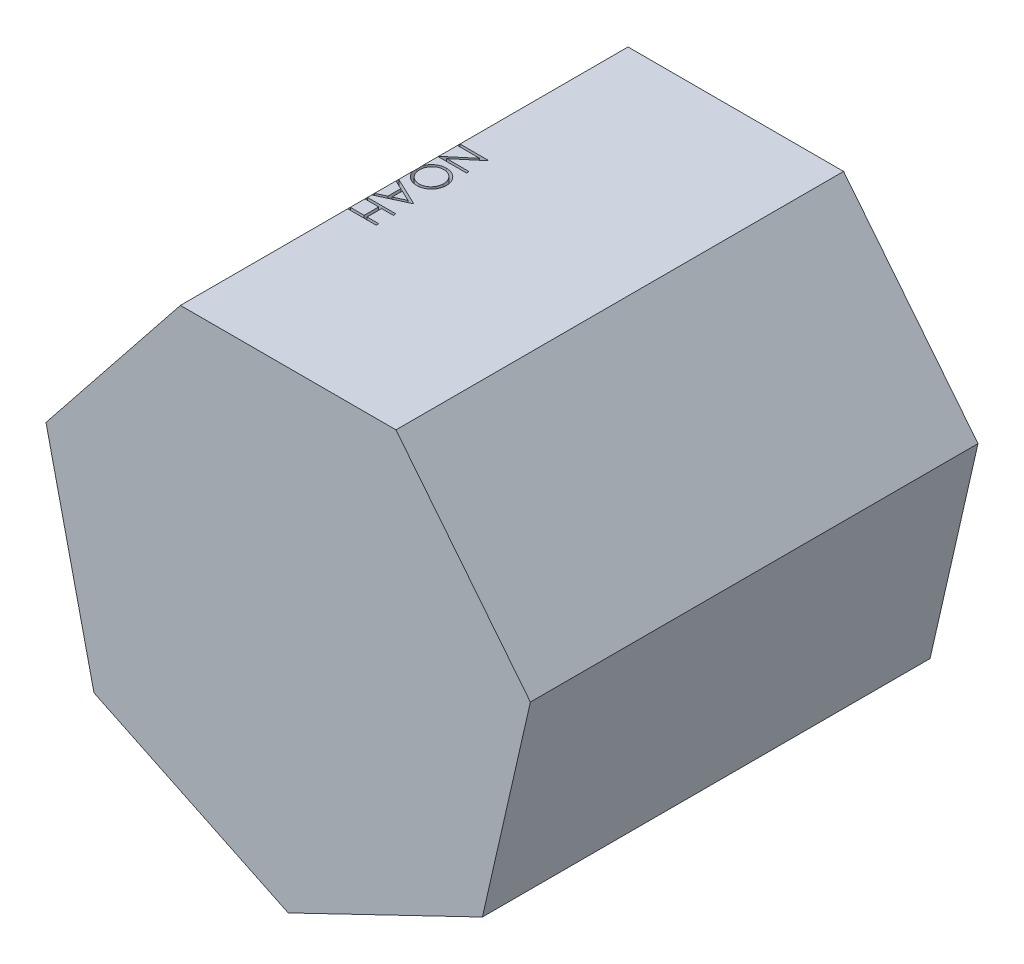
from build123d import *

# Parameters (mm, degrees)
BOSS_EXTRUDE1_DEPTH = 200
CUT_EXTRUDE1_DEPTH  = 1
SKETCH4_W           = 1.794871794
SKETCH4_H           = 20.512820513
SKETCH4_W_2         = 1.794871795
SKETCH4_H_2         = 14.615384616
CUT_EXTRUDE3_DEPTH  = 1
CUT_EXTRUDE5_DEPTH  = 2
CUT_EXTRUDE6_DEPTH  = 10
SKETCH9_W           = 12.5
SKETCH9_H           = 1.121794872
CUT_EXTRUDE7_DEPTH  = 5


with BuildPart() as part:
    # Sketch1 → Boss-Extrude1 (new body)
    with BuildSketch(Plane.XY):
        Polygon((0, -110.991626417), (86.776747824, -69.202147163), (108.208834613, 24.697960372), (48.157461881, 100), (-48.157461881, 100), (-108.208834613, 24.697960372), (-86.776747824, -69.202147163), align=None)
    extrude(amount=BOSS_EXTRUDE1_DEPTH)

    # Sketch2 → Cut-Extrude1 (cut)
    # profile 1 of 6: a face of its own
    with BuildSketch(Plane(origin=(-78.183148247, 62.348980186, 0), x_dir=(0, 0, 1), z_dir=(-0.7818314824680302, 0.6234898018587328, 0))):
        with BuildLine():
            Line((145.128205128, -35.364993932), (143.91025641, -36.619000342))
            add(Edge.make_bspline(
                [(143.91025641, -36.619000342), (143.805167819, -36.497210935), (143.602569386, -36.262415294), (143.281246637, -35.9484892), (142.961111759, -35.684849549), (142.64654711, -35.462265212), (142.329642716, -35.293984375), (142.014117469, -35.171156592), (141.699644678, -35.095146274), (141.489438762, -35.085349481), (141.386217949, -35.080538804)],
                knots=[0, 0, 0, 0, 1.26578478, 2.440284043, 3.530471711, 4.527705817, 5.468200915, 6.346673037, 7.188140097, 8, 8, 8, 8], degree=3))
            add(Edge.make_bspline(
                [(141.386217949, -35.080538804), (141.25970715, -35.086680935), (141.010751801, -35.09876778), (140.65403284, -35.219415954), (140.322886411, -35.404608745), (140.036275097, -35.667286365), (139.793488354, -35.968796473), (139.616267319, -36.305918329), (139.50789027, -36.668478579), (139.494148944, -36.920077766), (139.487179487, -37.04768624)],
                knots=[0, 0, 0, 0, 0.99966794, 1.967205029, 2.953328237, 3.988086729, 5.028030931, 6.008226631, 6.989793394, 8, 8, 8, 8], degree=3))
            add(Edge.make_bspline(
                [(139.487179487, -37.04768624), (139.493526986, -37.163183635), (139.50620409, -37.39385284), (139.604756542, -37.734127319), (139.761705526, -38.065881823), (139.908392351, -38.26909843), (139.983974359, -38.373808035)],
                knots=[0, 0, 0, 0, 0.960159726, 1.917612774, 2.927026955, 4, 4, 4, 4], degree=3))
            add(Edge.make_bspline(
                [(139.983974359, -38.373808035), (140.029480038, -38.429719945), (140.126333139, -38.5487214), (140.308096082, -38.713886276), (140.513938956, -38.896413425), (140.761481457, -39.078909636), (141.040058759, -39.271090923), (141.355711812, -39.465388826), (141.698423269, -39.676614111), (141.943779307, -39.810582314), (142.071314103, -39.880218291)],
                knots=[0, 0, 0, 0, 0.66740084, 1.420478572, 2.27185888, 3.217733974, 4.268547843, 5.408967954, 6.65319498, 8, 8, 8, 8], degree=3))
            add(Edge.make_bspline(
                [(142.071314103, -39.880218291), (142.226820257, -39.967332021), (142.527206943, -40.135607064), (142.954022756, -40.396805369), (143.341377276, -40.656413508), (143.69255252, -40.911655073), (144.000791428, -41.169671459), (144.275446014, -41.420572928), (144.509665694, -41.671940404), (144.640830989, -41.847558196), (144.703525641, -41.931500342)],
                knots=[0, 0, 0, 0, 1.27191281, 2.456916733, 3.569705269, 4.599008579, 5.553216877, 6.436649441, 7.252746552, 8, 8, 8, 8], degree=3))
            add(Edge.make_bspline(
                [(144.703525641, -41.931500342), (144.807585798, -42.101020845), (145.014684822, -42.438398109), (145.232160631, -42.99393198), (145.358219344, -43.583134851), (145.375717745, -43.986176109), (145.384615385, -44.191115727)],
                knots=[0, 0, 0, 0, 0.995354457, 1.980940102, 2.973342416, 4, 4, 4, 4], degree=3))
            add(Edge.make_bspline(
                [(145.384615385, -44.191115727), (145.380503763, -44.335510848), (145.372401363, -44.620057209), (145.316069552, -45.039113379), (145.219183973, -45.439882279), (145.087219665, -45.826712477), (144.909023248, -46.192192132), (144.700178693, -46.545542126), (144.449464911, -46.879118874), (144.163228479, -47.19248436), (143.849825657, -47.478688631), (143.515504866, -47.730254082), (143.159854405, -47.939250295), (142.78541554, -48.112195125), (142.391337517, -48.249728027), (141.977558721, -48.344942491), (141.545394409, -48.401929698), (141.251509791, -48.40984099), (141.101762821, -48.413872137)],
                knots=[0, 0, 0, 0, 1.032770009, 2.035186124, 3.017557409, 3.978232242, 4.952395191, 5.920591857, 6.910227898, 7.931268572, 8.952309245, 9.941945286, 10.918353717, 11.897095711, 12.887975737, 13.898235213, 14.929059601, 16, 16, 16, 16], degree=3))
            add(Edge.make_bspline(
                [(141.101762821, -48.413872137), (140.899664675, -48.408199564), (140.498276521, -48.396933237), (139.904620983, -48.291184316), (139.324502362, -48.126639208), (138.762310703, -47.899691013), (138.230618624, -47.613115511), (137.744156198, -47.269901833), (137.301233555, -46.881387562), (137.049129134, -46.583599501), (136.923076923, -46.43470547)],
                knots=[0, 0, 0, 0, 1.013940152, 2.01379169, 3.017749504, 4.037548394, 5.051665909, 6.043208538, 7.021604269, 8, 8, 8, 8], degree=3))
            Line((136.923076923, -46.43470547), (138.112980769, -45.080538804))
            add(Edge.make_bspline(
                [(138.112980769, -45.080538804), (138.225965986, -45.20256603), (138.445004913, -45.439134258), (138.795297581, -45.75413049), (139.151751301, -46.018137754), (139.510806653, -46.238957267), (139.877778621, -46.409102428), (140.250610702, -46.52863725), (140.628544554, -46.605461206), (140.88238533, -46.614479962), (141.009615385, -46.619000342)],
                knots=[0, 0, 0, 0, 1.179806542, 2.287233372, 3.337373186, 4.324005949, 5.273901747, 6.200048787, 7.097828587, 8, 8, 8, 8], degree=3))
            add(Edge.make_bspline(
                [(141.009615385, -46.619000342), (141.182860676, -46.611167057), (141.521352913, -46.595862133), (142.006174391, -46.456907321), (142.453823685, -46.239021882), (142.842528517, -45.929966464), (143.173398009, -45.570220335), (143.412987577, -45.164996796), (143.563137151, -44.726188472), (143.580771429, -44.422003886), (143.58974359, -44.267237522)],
                knots=[0, 0, 0, 0, 1.072336372, 2.095165389, 3.102688358, 4.141489647, 5.156069229, 6.117746104, 7.042326257, 8, 8, 8, 8], degree=3))
            add(Edge.make_bspline(
                [(143.58974359, -44.267237522), (143.583536194, -44.139753987), (143.571280521, -43.888054811), (143.475033252, -43.523767148), (143.322959811, -43.178228402), (143.173218963, -42.976001846), (143.096955128, -42.873006753)],
                knots=[0, 0, 0, 0, 1.013901739, 2.00181326, 2.98231254, 4, 4, 4, 4], degree=3))
            add(Edge.make_bspline(
                [(143.096955128, -42.873006753), (143.051112874, -42.821376112), (142.951251889, -42.708905929), (142.768079082, -42.546476907), (142.548754155, -42.371402054), (142.290810367, -42.186650118), (141.993727727, -41.994658087), (141.656302153, -41.796433217), (141.283156139, -41.582560499), (141.01932396, -41.440733897), (140.881410256, -41.366596496)],
                knots=[0, 0, 0, 0, 0.615000592, 1.339693406, 2.178160186, 3.116406724, 4.166410947, 5.330106347, 6.604359322, 8, 8, 8, 8], degree=3))
            add(Edge.make_bspline(
                [(140.881410256, -41.366596496), (140.732572313, -41.283515744), (140.443928042, -41.122395651), (140.035086379, -40.871446621), (139.666244355, -40.616205051), (139.328526786, -40.370988827), (139.030463897, -40.122869147), (138.773229907, -39.871570567), (138.546697245, -39.62722779), (138.421283463, -39.45410038), (138.361378205, -39.371404188)],
                knots=[0, 0, 0, 0, 1.262093308, 2.447601706, 3.550203992, 4.582594899, 5.537233252, 6.418365656, 7.244515135, 8, 8, 8, 8], degree=3))
            add(Edge.make_bspline(
                [(138.361378205, -39.371404188), (138.257774779, -39.204857817), (138.05053172, -38.871706872), (137.849302056, -38.315647005), (137.710981891, -37.730246678), (137.698625376, -37.326321796), (137.692307692, -37.119801624)],
                knots=[0, 0, 0, 0, 0.985009483, 1.970363186, 2.962279964, 4, 4, 4, 4], degree=3))
            add(Edge.make_bspline(
                [(137.692307692, -37.119801624), (137.695360237, -36.98479935), (137.701334499, -36.720580773), (137.749014794, -36.332358943), (137.835824572, -35.96351235), (137.944709844, -35.608501704), (138.096041298, -35.274204024), (138.276875042, -34.956161332), (138.489374613, -34.654813229), (138.734193418, -34.374795331), (139.003374248, -34.120456324), (139.294201504, -33.898749878), (139.600134398, -33.709570708), (139.922468224, -33.550912648), (140.264299498, -33.430904747), (140.623238849, -33.348291118), (140.998559734, -33.293118531), (141.255137597, -33.28818662), (141.386217949, -33.285667009)],
                knots=[0, 0, 0, 0, 1.087655834, 2.128696564, 3.144119009, 4.137814668, 5.115653402, 6.093965665, 7.082169637, 8.081268856, 9.086088321, 10.061021666, 11.022561449, 11.980240094, 12.950172527, 13.934149372, 14.944599409, 16, 16, 16, 16], degree=3))
            add(Edge.make_bspline(
                [(141.386217949, -33.285667009), (141.541601169, -33.291977527), (141.855282436, -33.304716943), (142.325880299, -33.405892317), (142.795785111, -33.572367198), (143.266204254, -33.802288531), (143.733691622, -34.099813536), (144.202359374, -34.459409533), (144.677833833, -34.878710759), (144.974727051, -35.199277761), (145.128205128, -35.364993932)],
                knots=[0, 0, 0, 0, 0.845714091, 1.707292901, 2.609013841, 3.555613372, 4.552488639, 5.621697636, 6.770543573, 8, 8, 8, 8], degree=3))
        make_face()
    # profile 2 of 6: a face of its own
    with BuildSketch(Plane(origin=(-78.183148247, 62.348980186, 0), x_dir=(0, 0, 1), z_dir=(-0.7818314824680302, 0.6234898018587328, 0))):
        with BuildLine():
            Line((132.251602564, -43.542077265), (133.846153846, -44.379417009))
            add(Edge.make_bspline(
                [(133.846153846, -44.379417009), (133.719087588, -44.604807473), (133.471866968, -45.043328061), (133.046719837, -45.645795835), (132.601050851, -46.187782783), (132.114742462, -46.654809379), (131.602344297, -47.06196015), (131.061014841, -47.418176291), (130.487935882, -47.721710693), (129.883080312, -47.977439424), (129.241368591, -48.174065104), (128.56124564, -48.312946367), (127.841408524, -48.398793616), (127.348001782, -48.408765849), (127.095352564, -48.413872137)],
                knots=[0, 0, 0, 0, 1.120438281, 2.179929193, 3.190490725, 4.156257408, 5.095198341, 6.022838206, 6.959905092, 7.901321166, 8.864066838, 9.862729781, 10.905609505, 12, 12, 12, 12], degree=3))
            add(Edge.make_bspline(
                [(127.095352564, -48.413872137), (126.814541264, -48.40731685), (126.266759769, -48.394529383), (125.469389785, -48.284286729), (124.718650252, -48.104444679), (124.014583375, -47.853213013), (123.35891336, -47.525056876), (122.750337047, -47.125288408), (122.185654042, -46.655961239), (121.682658561, -46.113010133), (121.229836374, -45.531970377), (120.83026026, -44.92650818), (120.496217797, -44.298146897), (120.224488596, -43.65088676), (120.005032225, -42.988807368), (119.852079632, -42.305884696), (119.763909643, -41.603967072), (119.750398526, -41.129125154), (119.743589744, -40.889833676)],
                knots=[0, 0, 0, 0, 1.145258523, 2.234067595, 3.276747158, 4.290159414, 5.277019952, 6.260822364, 7.254936242, 8.264827045, 9.274100331, 10.257902744, 11.220704747, 12.172965371, 13.118907548, 14.062713208, 15.023725156, 16, 16, 16, 16], degree=3))
            add(Edge.make_bspline(
                [(119.743589744, -40.889833676), (119.74964198, -40.665291788), (119.761636713, -40.220279418), (119.837241212, -39.561619163), (119.971231458, -38.921456578), (120.155096166, -38.299259732), (120.392531859, -37.696070395), (120.683001683, -37.11152146), (121.026958127, -36.546234946), (121.292516263, -36.189645611), (121.426282051, -36.010025983)],
                knots=[0, 0, 0, 0, 1.024358464, 2.0301432, 3.019427413, 4.004406732, 4.986367066, 5.972626655, 6.978780325, 8, 8, 8, 8], degree=3))
            add(Edge.make_bspline(
                [(121.426282051, -36.010025983), (121.60746881, -35.79363244), (121.964102791, -35.367700152), (122.567281964, -34.808052576), (123.220425943, -34.339231003), (123.915349521, -33.950618797), (124.660129373, -33.655340814), (125.444753893, -33.435297487), (126.278157243, -33.311994567), (126.847901362, -33.294578375), (127.139423077, -33.285667009)],
                knots=[0, 0, 0, 0, 1.030682036, 2.02871468, 2.997146059, 3.962720338, 4.930598197, 5.918074684, 6.934738563, 8, 8, 8, 8], degree=3))
            add(Edge.make_bspline(
                [(127.139423077, -33.285667009), (127.439123679, -33.293404431), (128.027067941, -33.30858349), (128.884394347, -33.449305395), (129.695598442, -33.67246285), (130.460355609, -33.987627367), (131.178743385, -34.394253377), (131.84609224, -34.897921043), (132.473815168, -35.483167255), (132.839007048, -35.933242738), (133.024839744, -36.162269573)],
                knots=[0, 0, 0, 0, 1.056321875, 2.072262726, 3.055038591, 4.01806755, 4.982017516, 5.957941055, 6.960871419, 8, 8, 8, 8], degree=3))
            add(Edge.make_bspline(
                [(133.024839744, -36.162269573), (133.151279391, -36.334861467), (133.403317066, -36.678896431), (133.71901478, -37.239874471), (133.993057037, -37.826792153), (134.212102529, -38.449136708), (134.389471107, -39.099534309), (134.517795786, -39.782634564), (134.593050749, -40.498234058), (134.607843305, -40.985814375), (134.615384615, -41.234384958)],
                knots=[0, 0, 0, 0, 0.94817472, 1.890038105, 2.849395472, 3.817997239, 4.812318967, 5.836947057, 6.897266129, 8, 8, 8, 8], degree=3))
            Line((134.615384615, -41.234384958), (121.538461538, -41.234384958))
            add(Edge.make_bspline(
                [(121.538461538, -41.234384958), (121.547259289, -41.426959039), (121.564559712, -41.805648203), (121.645217673, -42.359766964), (121.772353523, -42.887614633), (121.951033881, -43.385232016), (122.167415854, -43.859118459), (122.432477093, -44.30575867), (122.748703115, -44.723118271), (123.101421398, -45.114930485), (123.494033371, -45.463849121), (123.907077641, -45.776144985), (124.346469441, -46.037891252), (124.808744203, -46.250347765), (125.293154404, -46.416669571), (125.799852662, -46.530199975), (126.327841898, -46.606240585), (126.687760379, -46.614695815), (126.87099359, -46.619000342)],
                knots=[0, 0, 0, 0, 1.094153842, 2.151609401, 3.174256925, 4.172055639, 5.149267565, 6.128595816, 7.11444997, 8.118368179, 9.117203808, 10.09244225, 11.054858984, 12.015122123, 12.976791628, 13.957293641, 14.960065497, 16, 16, 16, 16], degree=3))
            add(Edge.make_bspline(
                [(126.87099359, -46.619000342), (127.050143005, -46.615525733), (127.40560981, -46.608631441), (127.934986138, -46.54159195), (128.455783437, -46.433190375), (128.965846199, -46.285247575), (129.454822461, -46.10480842), (129.907654176, -45.887077805), (130.324112551, -45.646222109), (130.71335236, -45.370738252), (131.090900893, -45.033548612), (131.465429387, -44.612773063), (131.867010263, -44.115130047), (132.118379365, -43.740583384), (132.251602564, -43.542077265)],
                knots=[0, 0, 0, 0, 0.99110716, 1.966546729, 2.947904876, 3.932708344, 4.903319531, 5.828989031, 6.710028674, 7.56322171, 8.463672341, 9.504779593, 10.677557249, 12, 12, 12, 12], degree=3))
        make_face()
        with BuildLine():
            add(Edge.make_bspline(
                [(132.820512821, -39.439513163), (132.754817823, -39.201439599), (132.6283761, -38.743224624), (132.364168303, -38.10870525), (132.066616642, -37.544774387), (131.714492463, -37.055747912), (131.315528317, -36.621442124), (130.854698701, -36.241907352), (130.337922167, -35.90237906), (129.767869935, -35.615793349), (129.164202592, -35.371851299), (128.532167209, -35.208279209), (127.887265564, -35.096224681), (127.451069642, -35.085789776), (127.231570513, -35.080538804)],
                knots=[0, 0, 0, 0, 1.154881502, 2.222775134, 3.210006277, 4.132804581, 5.035138423, 5.962687519, 6.919655026, 7.923214229, 8.944639381, 9.960483929, 10.97369054, 12, 12, 12, 12], degree=3))
            add(Edge.make_bspline(
                [(127.231570513, -35.080538804), (127.052430864, -35.08403407), (126.698309441, -35.090943476), (126.176589051, -35.156487072), (125.6755622, -35.264829043), (125.191531985, -35.413200223), (124.730841309, -35.610963666), (124.284014062, -35.842867818), (123.862411798, -36.125962583), (123.598747252, -36.341727468), (123.465544872, -36.450731112)],
                knots=[0, 0, 0, 0, 1.04873581, 2.073130211, 3.073294108, 4.04793562, 5.032784715, 6.005352987, 6.992311501, 8, 8, 8, 8], degree=3))
            add(Edge.make_bspline(
                [(123.465544872, -36.450731112), (123.370154689, -36.536984344), (123.177108208, -36.711539864), (122.919162371, -37.012278187), (122.672188241, -37.336572828), (122.447424511, -37.696830683), (122.241266874, -38.08894942), (122.048352719, -38.509621621), (121.874716078, -38.962039509), (121.777024021, -39.27731059), (121.726762821, -39.439513163)],
                knots=[0, 0, 0, 0, 0.879870761, 1.780643979, 2.707998968, 3.669668524, 4.684282772, 5.740141944, 6.837334558, 8, 8, 8, 8], degree=3))
            Line((121.726762821, -39.439513163), (132.820512821, -39.439513163))
        make_face(mode=Mode.SUBTRACT)
    # profile 3 of 6: a face of its own
    with BuildSketch(Plane(origin=(-78.183148247, 62.348980186, 0), x_dir=(0, 0, 1), z_dir=(-0.7818314824680302, 0.6234898018587328, 0))):
        with BuildLine():
            Line((111.538461538, -33.542077265), (113.333333333, -33.542077265))
            Line((113.333333333, -33.542077265), (113.333333333, -35.693519573))
            add(Edge.make_bspline(
                [(113.333333333, -35.693519573), (113.465840526, -35.493200554), (113.719259503, -35.110091987), (114.140476242, -34.603410267), (114.571923849, -34.183895715), (115.015667777, -33.849589893), (115.474971205, -33.599229214), (115.939753786, -33.415840442), (116.4173279, -33.307398641), (116.738253181, -33.29292059), (116.899038462, -33.285667009)],
                knots=[0, 0, 0, 0, 1.2804753, 2.448899062, 3.506932113, 4.484331642, 5.4025378, 6.288909075, 7.142734305, 8, 8, 8, 8], degree=3))
            add(Edge.make_bspline(
                [(116.899038462, -33.285667009), (117.023760327, -33.292470018), (117.280383671, -33.306467651), (117.668855613, -33.404815221), (118.06910391, -33.561832493), (118.327060408, -33.709490908), (118.461538462, -33.786468291)],
                knots=[0, 0, 0, 0, 0.901110191, 1.854092781, 2.881294221, 4, 4, 4, 4], degree=3))
            Line((118.461538462, -33.786468291), (117.475961538, -35.34095547))
            add(Edge.make_bspline(
                [(117.475961538, -35.34095547), (117.389624275, -35.302439664), (117.22573962, -35.22932929), (116.985999242, -35.142803518), (116.764963032, -35.091855428), (116.624142698, -35.084137042), (116.55849359, -35.080538804)],
                knots=[0, 0, 0, 0, 1.180555205, 2.24091978, 3.179933427, 4, 4, 4, 4], degree=3))
            add(Edge.make_bspline(
                [(116.55849359, -35.080538804), (116.414460827, -35.090139017), (116.120675741, -35.10972067), (115.689335745, -35.263656715), (115.270780285, -35.512372372), (114.938370786, -35.788207297), (114.680986483, -36.054194711), (114.497328052, -36.286471297), (114.328855212, -36.54692062), (114.167882524, -36.831090242), (114.021217986, -37.143832219), (113.884334162, -37.48202201), (113.760569231, -37.846051318), (113.689996407, -38.099665719), (113.653846154, -38.229577265)],
                knots=[0, 0, 0, 0, 1.125678352, 2.296057538, 3.5422874, 4.923748041, 5.663163013, 6.437101912, 7.23742474, 8.08941207, 8.991984279, 9.93940061, 10.944477711, 12, 12, 12, 12], degree=3))
            add(Edge.make_bspline(
                [(113.653846154, -38.229577265), (113.626803906, -38.345446829), (113.566907382, -38.602089107), (113.508670023, -39.032652105), (113.45112992, -39.541358727), (113.410577815, -40.129624972), (113.372989003, -40.795981794), (113.351788533, -41.54144434), (113.334056302, -42.366777776), (113.333581634, -42.94377408), (113.333333333, -43.245602906)],
                knots=[0, 0, 0, 0, 0.566838948, 1.255505196, 2.06880316, 3.007127437, 4.065329342, 5.249902469, 6.561414163, 8, 8, 8, 8], degree=3))
            Line((113.333333333, -43.245602906), (113.333333333, -48.157461881))
            Line((113.333333333, -48.157461881), (111.538461538, -48.157461881))
            Line((111.538461538, -48.157461881), (111.538461538, -33.542077265))
        make_face()
    # profile 4 of 6: a face of its own
    with BuildSketch(Plane(origin=(-78.183148247, 62.348980186, 0), x_dir=(0, 0, 1), z_dir=(-0.7818314824680302, 0.6234898018587328, 0))):
        with BuildLine():
            Line((107.948717949, -27.644641368), (107.948717949, -48.157461881))
            Line((107.948717949, -48.157461881), (106.153846154, -48.157461881))
            Line((106.153846154, -48.157461881), (106.153846154, -45.629417009))
            add(Edge.make_bspline(
                [(106.153846154, -45.629417009), (105.951453065, -45.858214689), (105.556480406, -46.304716238), (104.896816875, -46.888042938), (104.197570144, -47.370204775), (103.462134023, -47.759632865), (102.691172632, -48.052158901), (101.886394991, -48.26007981), (101.047472814, -48.393758868), (100.474602216, -48.407107565), (100.184294872, -48.413872137)],
                knots=[0, 0, 0, 0, 1.074387032, 2.096679803, 3.090159297, 4.057316773, 5.018401886, 5.985159533, 6.978961417, 8, 8, 8, 8], degree=3))
            add(Edge.make_bspline(
                [(100.184294872, -48.413872137), (99.926192278, -48.406864296), (99.417202536, -48.393044522), (98.668464953, -48.285831358), (97.947937813, -48.113656377), (97.254940255, -47.874222723), (96.593956567, -47.556618028), (95.959327443, -47.176382325), (95.354340631, -46.723577582), (94.788217551, -46.205931705), (94.266891835, -45.643674636), (93.809398849, -45.043985797), (93.427952678, -44.409458346), (93.108980788, -43.748126038), (92.863287391, -43.054897926), (92.692009481, -42.332171252), (92.584921215, -41.580800546), (92.571107153, -41.069146129), (92.564102564, -40.80970547)],
                knots=[0, 0, 0, 0, 1.033919861, 2.038935746, 3.024066025, 3.998881131, 4.97069526, 5.957263378, 6.95902576, 7.993208707, 9.027059324, 10.027763471, 11.009749337, 11.988697705, 12.965288445, 13.950418724, 14.960734635, 16, 16, 16, 16], degree=3))
            add(Edge.make_bspline(
                [(92.564102564, -40.80970547), (92.571262401, -40.555627164), (92.585417011, -40.05332806), (92.690863982, -39.314592643), (92.868184031, -38.603059724), (93.117028875, -37.921020049), (93.43612576, -37.267648333), (93.824286258, -36.642482476), (94.281538399, -36.043800205), (94.80869501, -35.485678909), (95.37975084, -34.970132542), (95.990657874, -34.522080853), (96.626219481, -34.135127432), (97.296293827, -33.828536138), (97.990962997, -33.580484112), (98.716411259, -33.408867152), (99.46962028, -33.307739602), (99.98099452, -33.293095235), (100.240384615, -33.285667009)],
                knots=[0, 0, 0, 0, 1.020392517, 2.01726096, 2.990465484, 3.961182959, 4.928053699, 5.906110375, 6.912531644, 7.948652711, 8.985773172, 9.998621852, 10.987621588, 11.969261332, 12.953316658, 13.946091881, 14.958173133, 16, 16, 16, 16], degree=3))
            add(Edge.make_bspline(
                [(100.240384615, -33.285667009), (100.538766374, -33.294621843), (101.124456606, -33.312199188), (101.981019586, -33.459092714), (102.791234504, -33.70573773), (103.559765861, -34.043402195), (104.282031919, -34.482263631), (104.963327008, -35.012271904), (105.591803139, -35.648427025), (105.963642125, -36.126207444), (106.153846154, -36.370602906)],
                knots=[0, 0, 0, 0, 1.031072012, 2.023879775, 2.993683497, 3.952812103, 4.918022106, 5.908088563, 6.929940113, 8, 8, 8, 8], degree=3))
            Line((106.153846154, -36.370602906), (106.153846154, -27.644641368))
            Line((106.153846154, -27.644641368), (107.948717949, -27.644641368))
        make_face()
        with BuildLine():
            add(Edge.make_bspline(
                [(100.264423077, -35.080538804), (100.002055432, -35.089873877), (99.484183432, -35.108299825), (98.723931992, -35.252148369), (97.996426768, -35.491488909), (97.305306344, -35.818814058), (96.661487963, -36.230406839), (96.086095559, -36.728243315), (95.574422979, -37.298740538), (95.144090041, -37.939324026), (94.793287201, -38.626055975), (94.546618447, -39.343909907), (94.383937034, -40.07993835), (94.367316916, -40.579153698), (94.358974359, -40.829737522)],
                knots=[0, 0, 0, 0, 1.031046209, 2.035121221, 3.029706178, 4.034933723, 5.034054252, 6.02443088, 7.017295772, 8.038157696, 9.050218397, 10.03989886, 11.016116709, 12, 12, 12, 12], degree=3))
            add(Edge.make_bspline(
                [(94.358974359, -40.829737522), (94.369630892, -41.078823849), (94.390902189, -41.576020168), (94.543763299, -42.313052035), (94.800219719, -43.031075133), (95.150174363, -43.723995095), (95.588383647, -44.367332812), (96.096318805, -44.948704941), (96.678891841, -45.448645445), (97.324191881, -45.867145866), (98.013380284, -46.205217414), (98.738145606, -46.44044964), (99.484863539, -46.592322672), (99.992591161, -46.610062539), (100.248397436, -46.619000342)],
                knots=[0, 0, 0, 0, 0.979072187, 1.954306742, 2.945804271, 3.96968567, 4.997920485, 5.998718438, 6.996577872, 8.005894225, 9.015743152, 10.005417472, 10.995077863, 12, 12, 12, 12], degree=3))
            add(Edge.make_bspline(
                [(100.248397436, -46.619000342), (100.508091737, -46.609514834), (101.024597946, -46.590649099), (101.787104848, -46.446184726), (102.527076064, -46.207505878), (103.234431655, -45.876653726), (103.893380976, -45.466611692), (104.484797419, -44.986571172), (104.984888667, -44.428267263), (105.408846436, -43.814687531), (105.741277389, -43.142047551), (105.983426298, -42.425852175), (106.126591474, -41.666076472), (106.144635644, -41.146854032), (106.153846154, -40.881820855)],
                knots=[0, 0, 0, 0, 1.01762866, 2.023962475, 3.030623092, 4.058876274, 5.077231937, 6.066672613, 7.034107872, 8.005628644, 8.981990164, 9.965428785, 10.961468474, 12, 12, 12, 12], degree=3))
            add(Edge.make_bspline(
                [(106.153846154, -40.881820855), (106.148362403, -40.679890395), (106.137568646, -40.282427347), (106.055108249, -39.698841533), (105.923937241, -39.140363098), (105.739101984, -38.606404875), (105.496294644, -38.099919073), (105.203450268, -37.617269014), (104.855419126, -37.160964949), (104.45780372, -36.737290258), (104.022573991, -36.350853331), (103.562033759, -36.005914812), (103.070726634, -35.722550397), (102.556914994, -35.488028845), (102.019707369, -35.301405132), (101.454732398, -35.176904024), (100.86799533, -35.091416476), (100.467732156, -35.084202871), (100.264423077, -35.080538804)],
                knots=[0, 0, 0, 0, 1.050140795, 2.067009409, 3.05949893, 4.030605086, 5.00011959, 5.97591094, 6.962425594, 7.979863591, 8.993523472, 9.986985069, 10.967611495, 11.937549037, 12.921786183, 13.919465291, 14.943216303, 16, 16, 16, 16], degree=3))
        make_face(mode=Mode.SUBTRACT)
    # profile 5 of 6: a face of its own
    with BuildSketch(Plane(origin=(-78.183148247, 62.348980186, 0), x_dir=(0, 0, 1), z_dir=(-0.7818314824680302, 0.6234898018587328, 0))):
        with BuildLine():
            Line((76.153846154, -33.542077265), (77.948717949, -33.542077265))
            Line((77.948717949, -33.542077265), (77.948717949, -36.178295214))
            add(Edge.make_bspline(
                [(77.948717949, -36.178295214), (78.140361578, -35.939193941), (78.512252727, -35.475209578), (79.131591774, -34.865377723), (79.786128347, -34.36283358), (80.471854082, -33.962240472), (81.189699854, -33.660259751), (81.935289968, -33.442168716), (82.713088288, -33.311398268), (83.242027928, -33.294311237), (83.509615385, -33.285667009)],
                knots=[0, 0, 0, 0, 1.12780773, 2.188550248, 3.19190651, 4.159438251, 5.104880172, 6.052711206, 7.014878035, 8, 8, 8, 8], degree=3))
            add(Edge.make_bspline(
                [(83.509615385, -33.285667009), (83.780076151, -33.295639554), (84.30943311, -33.315158231), (85.080164889, -33.469539323), (85.800012853, -33.733226495), (86.466410315, -34.094438326), (87.067137248, -34.543618174), (87.594707828, -35.066919784), (88.031069241, -35.66884026), (88.323625601, -36.227258296), (88.516343588, -36.722622834), (88.637671231, -37.146889978), (88.740705411, -37.619565127), (88.830029685, -38.139219922), (88.890470325, -38.709495295), (88.938140562, -39.328053535), (88.972304529, -39.994694281), (88.973659998, -40.455760723), (88.974358974, -40.693519573)],
                knots=[0, 0, 0, 0, 1.235846778, 2.418850247, 3.575807741, 4.728682307, 5.871620074, 6.994088408, 8.11269785, 9.256955736, 9.865816715, 10.540099792, 11.271859618, 12.076849838, 12.949306005, 13.892391288, 14.913166135, 16, 16, 16, 16], degree=3))
            Line((88.974358974, -40.693519573), (88.974358974, -48.157461881))
            Line((88.974358974, -48.157461881), (87.179487179, -48.157461881))
            Line((87.179487179, -48.157461881), (87.179487179, -41.282461881))
            add(Edge.make_bspline(
                [(87.179487179, -41.282461881), (87.178383134, -41.083476481), (87.176271282, -40.702851277), (87.169610444, -40.15788543), (87.153554406, -39.66367641), (87.130992618, -39.22140574), (87.097969586, -38.831498102), (87.06355455, -38.493159378), (87.021468968, -38.206819135), (86.983966608, -38.034447236), (86.967147436, -37.957141368)],
                knots=[0, 0, 0, 0, 1.430800155, 2.736877192, 3.918605307, 4.986035426, 5.920637409, 6.731861385, 7.431261377, 8, 8, 8, 8], degree=3))
            add(Edge.make_bspline(
                [(86.967147436, -37.957141368), (86.906430113, -37.730220311), (86.789568052, -37.293467485), (86.500802434, -36.701042613), (86.136149973, -36.197052968), (85.691019405, -35.784614559), (85.169710401, -35.463638349), (84.573669585, -35.240930036), (83.908648781, -35.101637069), (83.440909452, -35.087767743), (83.197115385, -35.080538804)],
                knots=[0, 0, 0, 0, 1.084156227, 2.086665306, 3.027808233, 3.945421172, 4.874247719, 5.839848303, 6.874090471, 8, 8, 8, 8], degree=3))
            add(Edge.make_bspline(
                [(83.197115385, -35.080538804), (83.052728621, -35.08325883), (82.766990947, -35.088641693), (82.343276822, -35.14264911), (81.932281546, -35.230983142), (81.529880352, -35.350232499), (81.144121531, -35.514016895), (80.762611295, -35.69989901), (80.3997155, -35.931603079), (80.047696088, -36.189835201), (79.72019433, -36.4760021), (79.415460968, -36.777970729), (79.143815138, -37.099545608), (78.897708422, -37.435545308), (78.685261203, -37.790584382), (78.499814985, -38.161237562), (78.342468158, -38.547992698), (78.264281344, -38.81642162), (78.225160256, -38.950731112)],
                knots=[0, 0, 0, 0, 1.023777757, 2.026029729, 3.023749952, 4.003683103, 4.997618607, 5.993177895, 7.010360494, 8.046726602, 9.087585522, 10.09234134, 11.086953743, 12.070360549, 13.043493632, 14.017870808, 15.008233677, 16, 16, 16, 16], degree=3))
            add(Edge.make_bspline(
                [(78.225160256, -38.950731112), (78.202647979, -39.049332272), (78.153639928, -39.26398184), (78.100707472, -39.616235665), (78.052664184, -40.023721236), (78.012452992, -40.485963048), (77.987850612, -41.004579477), (77.961025487, -41.577355693), (77.951259424, -42.206575627), (77.94958883, -42.644642442), (77.948717949, -42.873006753)],
                knots=[0, 0, 0, 0, 0.615963638, 1.340920617, 2.168419149, 3.115676021, 4.16674242, 5.331190069, 6.6087489, 8, 8, 8, 8], degree=3))
            Line((77.948717949, -42.873006753), (77.948717949, -48.157461881))
            Line((77.948717949, -48.157461881), (76.153846154, -48.157461881))
            Line((76.153846154, -48.157461881), (76.153846154, -33.542077265))
        make_face()
    # profile 6 of 6: a face of its own
    with BuildSketch(Plane(origin=(-78.183148247, 62.348980186, 0), x_dir=(0, 0, 1), z_dir=(-0.7818314824680302, 0.6234898018587328, 0))):
        Polygon((63.846153846, -28.157461881), (73.076923077, -48.157461881), (71.125801282, -48.157461881), (68.169070513, -41.74720547), (59.102564103, -41.74720547), (56.065705128, -48.157461881), (54.102564103, -48.157461881), (63.58974359, -28.157461881), align=None)
        Polygon((63.697916667, -32.05970547), (60.080128205, -39.695923419), (67.223557692, -39.695923419), align=None, mode=Mode.SUBTRACT)
    extrude(amount=-CUT_EXTRUDE1_DEPTH, mode=Mode.SUBTRACT)

    # Sketch4 → Cut-Extrude3 (cut)
    # profile 1 of 6: a face of its own
    with BuildSketch(Plane(origin=(-97.492791218, -22.252093396, 0), x_dir=(0, 0, 1), z_dir=(-0.9749279121818235, -0.22252093395631528, 0))):
        Polygon((109.743589744, -33.542077265), (111.674679487, -33.542077265), (116.630608974, -44.735987522), (121.650641026, -33.542077265), (123.58974359, -33.542077265), (114.615384615, -53.542077265), (112.676282051, -53.542077265), (115.661057692, -46.90345547), align=None)
    # profile 2 of 6: a face of its own
    with BuildSketch(Plane(origin=(-97.492791218, -22.252093396, 0), x_dir=(0, 0, 1), z_dir=(-0.9749279121818235, -0.22252093395631528, 0))):
        with Locations((106.282051282, -37.901051624)):
            Rectangle(SKETCH4_W, SKETCH4_H)
    # profile 3 of 6: a face of its own
    with BuildSketch(Plane(origin=(-97.492791218, -22.252093396, 0), x_dir=(0, 0, 1), z_dir=(-0.9749279121818235, -0.22252093395631528, 0))):
        with Locations((100.641025641, -37.901051624)):
            Rectangle(SKETCH4_W, SKETCH4_H)
    # profile 4 of 6: a face of its own
    with BuildSketch(Plane(origin=(-97.492791218, -22.252093396, 0), x_dir=(0, 0, 1), z_dir=(-0.9749279121818235, -0.22252093395631528, 0))):
        with BuildLine():
            add(Edge.make_bspline(
                [(94.735576923, -27.388231112), (94.84695587, -27.393397697), (95.065057241, -27.403514863), (95.380447342, -27.490151874), (95.667630268, -27.63700722), (95.92236017, -27.834033968), (96.14094238, -28.065745073), (96.293975011, -28.335807749), (96.39233156, -28.6275714), (96.404209019, -28.831086195), (96.41025641, -28.93470547)],
                knots=[0, 0, 0, 0, 1.055194115, 2.066272739, 3.074728998, 4.095836921, 5.109056067, 6.073838105, 7.019297344, 8, 8, 8, 8], degree=3))
            add(Edge.make_bspline(
                [(96.41025641, -28.93470547), (96.40407264, -29.035634917), (96.391848058, -29.235160489), (96.294050982, -29.521866043), (96.139638194, -29.788176235), (95.922500333, -30.019437436), (95.667593128, -30.216355264), (95.380457209, -30.363239487), (95.065054646, -30.449868843), (94.846954993, -30.459987064), (94.735576923, -30.465154188)],
                knots=[0, 0, 0, 0, 0.96129708, 1.900370562, 2.859976407, 3.87933698, 4.906634145, 5.921202961, 6.938410037, 8, 8, 8, 8], degree=3))
            add(Edge.make_bspline(
                [(94.735576923, -30.465154188), (94.625472494, -30.460184359), (94.411168607, -30.450511234), (94.100500936, -30.361539704), (93.815766711, -30.216305001), (93.56054001, -30.0207268), (93.34779605, -29.786755959), (93.192948476, -29.522028565), (93.095377265, -29.235119111), (93.083122244, -29.035621017), (93.076923077, -28.93470547)],
                knots=[0, 0, 0, 0, 1.054934014, 2.053291228, 3.073705704, 4.106921865, 5.123545215, 6.088680038, 7.033164197, 8, 8, 8, 8], degree=3))
            add(Edge.make_bspline(
                [(93.076923077, -28.93470547), (93.082986429, -28.831100616), (93.094895235, -28.627614144), (93.193021613, -28.335642527), (93.346506229, -28.067176802), (93.560680878, -27.832745377), (93.815729222, -27.637057178), (94.100510623, -27.49185157), (94.411166048, -27.402872488), (94.625471625, -27.393200406), (94.735576923, -27.388231112)],
                knots=[0, 0, 0, 0, 0.98631895, 1.937192651, 2.907499808, 3.917963147, 4.944918757, 5.95915025, 6.951458133, 8, 8, 8, 8], degree=3))
        make_face()
    # profile 5 of 6: a face of its own
    with BuildSketch(Plane(origin=(-97.492791218, -22.252093396, 0), x_dir=(0, 0, 1), z_dir=(-0.9749279121818235, -0.22252093395631528, 0))):
        with Locations((94.743589744, -40.849769573)):
            Rectangle(SKETCH4_W_2, SKETCH4_H_2)
    # profile 6 of 6: a face of its own
    with BuildSketch(Plane(origin=(-97.492791218, -22.252093396, 0), x_dir=(0, 0, 1), z_dir=(-0.9749279121818235, -0.22252093395631528, 0))):
        with BuildLine():
            Line((78.717948718, -28.157461881), (82.620192308, -28.157461881))
            add(Edge.make_bspline(
                [(82.620192308, -28.157461881), (82.811212183, -28.158466169), (83.181456242, -28.160412729), (83.719853053, -28.19060205), (84.224131971, -28.231765878), (84.694439241, -28.297080693), (85.13055754, -28.375890848), (85.533801182, -28.471329797), (85.90288788, -28.585767589), (86.343532089, -28.767746339), (86.845935865, -29.038164444), (87.38992668, -29.437756245), (87.855093762, -29.926513177), (88.256158432, -30.477842637), (88.575021973, -31.084332761), (88.805703672, -31.731528125), (88.951748674, -32.411080936), (88.966768298, -32.877613381), (88.974358974, -33.113391368)],
                knots=[0, 0, 0, 0, 1.001505555, 1.941167018, 2.826882275, 3.653841531, 4.429895133, 5.150066043, 5.825578002, 6.45369114, 7.647487171, 8.808567382, 9.977351308, 11.170798116, 12.373658725, 13.556498008, 14.765093433, 16, 16, 16, 16], degree=3))
            add(Edge.make_bspline(
                [(88.974358974, -33.113391368), (88.968112012, -33.334263115), (88.955836141, -33.768296926), (88.838448945, -34.403120408), (88.654673697, -35.007413087), (88.39921513, -35.578969575), (88.067203723, -36.104875936), (87.673727617, -36.589374599), (87.199003031, -37.011952067), (86.843327374, -37.248197225), (86.662660256, -37.36819906)],
                knots=[0, 0, 0, 0, 1.044552857, 2.05264487, 3.044412934, 4.028983338, 5.005914585, 5.980388656, 6.974128949, 8, 8, 8, 8], degree=3))
            add(Edge.make_bspline(
                [(86.662660256, -37.36819906), (86.8898627, -37.455427626), (87.324557256, -37.622317479), (87.922763042, -37.917377274), (88.438162156, -38.238303619), (88.874717276, -38.588771334), (89.248075304, -38.966535967), (89.574092113, -39.37713662), (89.852271394, -39.825929522), (90.090630957, -40.308235438), (90.276623849, -40.819129543), (90.415914731, -41.353819692), (90.495728726, -41.910388579), (90.507086676, -42.289162175), (90.512820513, -42.480378547)],
                knots=[0, 0, 0, 0, 1.27268992, 2.434971085, 3.483601985, 4.442670788, 5.356604649, 6.2567628, 7.179492994, 8.113709626, 9.066344395, 10.018646069, 10.999752585, 12, 12, 12, 12], degree=3))
            add(Edge.make_bspline(
                [(90.512820513, -42.480378547), (90.507238536, -42.675617817), (90.496255839, -43.059756549), (90.415227429, -43.624071603), (90.278032532, -44.163357013), (90.089054552, -44.681100914), (89.842412755, -45.176301682), (89.542252958, -45.649520333), (89.184358309, -46.096002223), (88.783999058, -46.52070864), (88.331072512, -46.902581711), (87.842411056, -47.242671463), (87.311860656, -47.522363247), (86.748134976, -47.757311941), (86.144910313, -47.936781647), (85.504895413, -48.062339212), (84.82864226, -48.146939423), (84.364586539, -48.15389488), (84.126602564, -48.157461881)],
                knots=[0, 0, 0, 0, 0.978564426, 1.925352924, 2.850884081, 3.763762016, 4.682927383, 5.618979971, 6.567305752, 7.547517671, 8.540179244, 9.531824382, 10.526200242, 11.540722885, 12.589160233, 13.674978461, 14.80764778, 16, 16, 16, 16], degree=3))
            Line((84.126602564, -48.157461881), (78.717948718, -48.157461881))
            Line((78.717948718, -48.157461881), (78.717948718, -28.157461881))
        make_face()
        with BuildLine():
            Line((80.512820513, -30.208743932), (80.512820513, -36.619000342))
            Line((80.512820513, -36.619000342), (81.71875, -36.619000342))
            add(Edge.make_bspline(
                [(81.71875, -36.619000342), (81.895028831, -36.616715068), (82.235635455, -36.612299452), (82.728892007, -36.599650783), (83.186749254, -36.564233392), (83.608416871, -36.528826181), (83.993230837, -36.471257108), (84.340338617, -36.402730692), (84.655187742, -36.330256948), (85.018270859, -36.207002737), (85.430116279, -36.024844593), (85.869162589, -35.742148387), (86.256216701, -35.405437797), (86.583057773, -35.016918016), (86.850551891, -34.58911124), (87.036344549, -34.128843351), (87.16232903, -33.647585454), (87.173709209, -33.317195438), (87.179487179, -33.14944906)],
                knots=[0, 0, 0, 0, 1.156816544, 2.235205308, 3.236616184, 4.169592532, 5.011045266, 5.787822928, 6.49130361, 7.128639758, 8.301311294, 9.436451833, 10.541879658, 11.654887649, 12.756523258, 13.837046038, 14.901820046, 16, 16, 16, 16], degree=3))
            add(Edge.make_bspline(
                [(87.179487179, -33.14944906), (87.176480436, -33.038444652), (87.170582379, -32.820697382), (87.122277793, -32.503272502), (87.040177367, -32.204736773), (86.934724263, -31.920999), (86.787360328, -31.660931284), (86.613854823, -31.415541594), (86.404222307, -31.193186632), (86.165609092, -30.985360927), (85.891274104, -30.801106482), (85.581381008, -30.639730693), (85.231737139, -30.509783397), (84.848235111, -30.395976812), (84.424971754, -30.316043704), (83.966831448, -30.249452918), (83.470061625, -30.215551535), (83.126375325, -30.211063747), (82.948717949, -30.208743932)],
                knots=[0, 0, 0, 0, 0.91205012, 1.789085906, 2.630437955, 3.453916878, 4.269457761, 5.079663411, 5.91843418, 6.774407191, 7.675494373, 8.627863946, 9.638891023, 10.736472738, 11.911756761, 13.175263542, 14.539845004, 16, 16, 16, 16], degree=3))
            Line((82.948717949, -30.208743932), (80.512820513, -30.208743932))
        make_face(mode=Mode.SUBTRACT)
        with BuildLine():
            Line((80.512820513, -38.670282394), (80.512820513, -46.106179829))
            Line((80.512820513, -46.106179829), (83.068910256, -46.106179829))
            add(Edge.make_bspline(
                [(83.068910256, -46.106179829), (83.251875547, -46.103986987), (83.604517025, -46.099760573), (84.113666911, -46.085963118), (84.585570362, -46.054578686), (85.018073994, -46.00517383), (85.415848009, -45.951582692), (85.774120598, -45.87951823), (86.095795989, -45.796952741), (86.468792034, -45.6693289), (86.888812081, -45.471063352), (87.341445546, -45.172124915), (87.743881078, -44.815991728), (88.085625417, -44.403815075), (88.365699637, -43.955636064), (88.569445094, -43.480519779), (88.695107133, -42.986316765), (88.710319529, -42.649364122), (88.717948718, -42.480378547)],
                knots=[0, 0, 0, 0, 1.160039823, 2.235823828, 3.228722157, 4.157150951, 4.99529583, 5.772374946, 6.472645482, 7.099169577, 8.269452708, 9.405989375, 10.527446681, 11.663510218, 12.788923519, 13.866172445, 14.929861265, 16, 16, 16, 16], degree=3))
            add(Edge.make_bspline(
                [(88.717948718, -42.480378547), (88.716370979, -42.374702316), (88.71324095, -42.16505442), (88.666037436, -41.856964025), (88.597386751, -41.558530463), (88.508635701, -41.268943374), (88.379381603, -40.993438367), (88.22848706, -40.726566598), (88.051564765, -40.467975287), (87.775883817, -40.141048124), (87.374901048, -39.764379479), (86.805148046, -39.395593752), (86.157306343, -39.098177711), (85.687434955, -38.97189499), (85.444711538, -38.906660599)],
                knots=[0, 0, 0, 0, 0.723448775, 1.435228256, 2.130040452, 2.821711965, 3.505591119, 4.210454504, 4.921174351, 5.648778258, 7.137944449, 8.670945889, 10.280296675, 12, 12, 12, 12], degree=3))
            add(Edge.make_bspline(
                [(85.444711538, -38.906660599), (85.347402419, -38.886917262), (85.136416177, -38.844109635), (84.792372861, -38.798922759), (84.399596467, -38.758665273), (83.957180026, -38.72888723), (83.464563791, -38.698106981), (82.920695684, -38.686136574), (82.327796743, -38.671855088), (81.916411758, -38.670820035), (81.702724359, -38.670282394)],
                knots=[0, 0, 0, 0, 0.634451884, 1.375622551, 2.216452059, 3.157844607, 4.20941857, 5.370758133, 6.634282058, 8, 8, 8, 8], degree=3))
            Line((81.702724359, -38.670282394), (80.512820513, -38.670282394))
        make_face(mode=Mode.SUBTRACT)
    extrude(amount=-CUT_EXTRUDE3_DEPTH, mode=Mode.SUBTRACT)

    # Sketch7 → Cut-Extrude5 (cut)
    # profile 1 of 4: a face of its own
    with BuildSketch(Plane(origin=(-43.388373912, -90.09688679, 0), x_dir=(-0.9009688679024196, 0.43388373911755734, 0), z_dir=(-0.43388373911755734, -0.9009688679024196, 0))):
        Polygon((-29.107461881, -116.241346154), (-29.107461881, -118.214272837), (-36.899949862, -123.201923077), (-29.107461881, -128.189573317), (-29.107461881, -130.1625), (-38.441656592, -124.190294471), (-48.157461881, -130.406730769), (-48.157461881, -128.433804087), (-39.983363323, -123.201923077), (-48.157461881, -117.970042067), (-48.157461881, -115.997115385), (-38.441656592, -122.217367788), align=None)
    # profile 2 of 4: a face of its own
    with BuildSketch(Plane(origin=(-43.388373912, -90.09688679, 0), x_dir=(-0.9009688679024196, 0.43388373911755734, 0), z_dir=(-0.43388373911755734, -0.9009688679024196, 0))):
        Polygon((-29.107461881, -103.419230769), (-29.107461881, -114.165384615), (-31.061308035, -114.165384615), (-31.061308035, -105.128846154), (-36.922846496, -105.128846154), (-36.922846496, -114.165384615), (-38.87669265, -114.165384615), (-38.87669265, -105.128846154), (-46.203615727, -105.128846154), (-46.203615727, -114.165384615), (-48.157461881, -114.165384615), (-48.157461881, -103.419230769), align=None)
    # profile 3 of 4: a face of its own
    with BuildSketch(Plane(origin=(-43.388373912, -90.09688679, 0), x_dir=(-0.9009688679024196, 0.43388373911755734, 0), z_dir=(-0.43388373911755734, -0.9009688679024196, 0))):
        Polygon((-29.107461881, -91.207692308), (-29.107461881, -92.917307692), (-46.203615727, -92.917307692), (-46.203615727, -100.244230769), (-48.157461881, -100.244230769), (-48.157461881, -91.207692308), align=None)
    # profile 4 of 4: a face of its own
    with BuildSketch(Plane(origin=(-43.388373912, -90.09688679, 0), x_dir=(-0.9009688679024196, 0.43388373911755734, 0), z_dir=(-0.43388373911755734, -0.9009688679024196, 0))):
        Polygon((-29.107461881, -79.484615385), (-48.157461881, -88.276923077), (-48.157461881, -86.418479567), (-42.05169265, -83.60219351), (-42.05169265, -74.966346154), (-48.157461881, -72.069921875), (-48.157461881, -70.203846154), (-29.107461881, -79.240384615), align=None)
        Polygon((-32.820532794, -79.343419471), (-40.097846496, -75.893659856), (-40.097846496, -82.701592548), align=None, mode=Mode.SUBTRACT)
    extrude(amount=-CUT_EXTRUDE5_DEPTH, mode=Mode.SUBTRACT)

    # Sketch8 → Cut-Extrude6 (cut)
    # profile 1 of 4: a face of its own
    with BuildSketch(Plane(origin=(0, 100, 0), x_dir=(1, 0, 0), z_dir=(0, 1, 0))):
        Polygon((-35.457461881, -116.444871795), (-35.457461881, -117.584615385), (-40.667718291, -117.584615385), (-40.667718291, -124.097435897), (-35.457461881, -124.097435897), (-35.457461881, -125.237179487), (-48.157461881, -125.237179487), (-48.157461881, -124.097435897), (-41.970282394, -124.097435897), (-41.970282394, -117.584615385), (-48.157461881, -117.584615385), (-48.157461881, -116.444871795), align=None)
    # profile 2 of 4: a face of its own
    with BuildSketch(Plane(origin=(0, 100, 0), x_dir=(1, 0, 0), z_dir=(0, 1, 0))):
        Polygon((-35.457461881, -108.629487179), (-48.157461881, -114.491025641), (-48.157461881, -113.252063301), (-44.08694906, -111.374539263), (-44.08694906, -105.617307692), (-48.157461881, -103.686358173), (-48.157461881, -102.442307692), (-35.457461881, -108.466666667), align=None)
        Polygon((-37.93284249, -108.535356571), (-42.784384958, -106.235516827), (-42.784384958, -110.774138622), align=None, mode=Mode.SUBTRACT)
    # profile 3 of 4: a face of its own
    with BuildSketch(Plane(origin=(0, 100, 0), x_dir=(1, 0, 0), z_dir=(0, 1, 0))):
        with BuildLine():
            add(Edge.make_bspline(
                [(-35.131820855, -94.057051282), (-35.137777135, -94.292212076), (-35.149475759, -94.754087278), (-35.239024877, -95.432902579), (-35.393950975, -96.080945176), (-35.600272061, -96.703508665), (-35.87555319, -97.29309285), (-36.20809658, -97.854335518), (-36.602631782, -98.385649822), (-37.052538677, -98.882165626), (-37.54384011, -99.33485669), (-38.069658759, -99.730369754), (-38.622794357, -100.064773061), (-39.205171672, -100.338860005), (-39.814227452, -100.554078242), (-40.453424678, -100.702542554), (-41.118563407, -100.79739035), (-41.572232686, -100.808477954), (-41.80237374, -100.814102564)],
                knots=[0, 0, 0, 0, 1.06508495, 2.091914715, 3.094501328, 4.079693967, 5.057647778, 6.035986298, 7.030177474, 8.050107388, 9.066943579, 10.051896531, 11.025616101, 11.9896488, 12.96281505, 13.945825876, 14.957941789, 16, 16, 16, 16], degree=3))
            add(Edge.make_bspline(
                [(-41.80237374, -100.814102564), (-42.030819528, -100.808478788), (-42.481112642, -100.797393673), (-43.142030315, -100.702434604), (-43.777369784, -100.553528319), (-44.386008741, -100.340856425), (-44.968818092, -100.068086196), (-45.522970411, -99.73142281), (-46.05242988, -99.338528298), (-46.546116358, -98.887401921), (-46.999696728, -98.39621765), (-47.395824709, -97.868916231), (-47.734345316, -97.316325), (-48.006552321, -96.734299744), (-48.223293712, -96.12932908), (-48.371207023, -95.495868475), (-48.466580679, -94.836744487), (-48.477535063, -94.387270597), (-48.483102906, -94.158814103)],
                knots=[0, 0, 0, 0, 1.04355943, 2.056976533, 3.044937463, 4.02179873, 4.997890911, 5.980248884, 6.980147982, 8.006253959, 9.032111064, 10.031228745, 11.015595249, 11.988180414, 12.962670953, 13.946861971, 14.95644057, 16, 16, 16, 16], degree=3))
            add(Edge.make_bspline(
                [(-48.483102906, -94.158814103), (-48.4774816, -93.928673981), (-48.466400509, -93.475006539), (-48.371388593, -92.809035749), (-48.22286982, -92.169375702), (-48.010419024, -91.557995902), (-47.736884961, -90.97469572), (-47.400752218, -90.419531569), (-47.004665945, -89.891836333), (-46.554140185, -89.396979922), (-46.062719856, -88.944748058), (-45.538884414, -88.54698402), (-44.987615834, -88.212789153), (-44.411186548, -87.939139618), (-43.811086528, -87.722693256), (-43.18354092, -87.574979237), (-42.532066206, -87.479421065), (-42.088499501, -87.468408398), (-41.863431432, -87.462820513)],
                knots=[0, 0, 0, 0, 1.053167129, 2.076072758, 3.073341244, 4.055601477, 5.033424535, 6.017524495, 7.021518915, 8.049444456, 9.077120685, 10.074910483, 11.055688766, 12.022980584, 12.991883888, 13.970269434, 14.970104079, 16, 16, 16, 16], degree=3))
            add(Edge.make_bspline(
                [(-41.863431432, -87.462820513), (-41.712363628, -87.464758697), (-41.412133808, -87.468610614), (-40.966313731, -87.515052358), (-40.527615271, -87.582306721), (-40.097513118, -87.679196945), (-39.675937038, -87.804177114), (-39.263749178, -87.958193971), (-38.85755432, -88.134697348), (-38.465083073, -88.344848999), (-38.085719427, -88.57413074), (-37.724207007, -88.824139442), (-37.387003401, -89.096618281), (-37.068690289, -89.387674962), (-36.774700551, -89.701338361), (-36.498624534, -90.032887854), (-36.243320076, -90.384058259), (-36.014149272, -90.755404959), (-35.803653104, -91.13746033), (-35.627906126, -91.532996203), (-35.472569367, -91.933667168), (-35.349122707, -92.343002492), (-35.250883119, -92.760055315), (-35.184131802, -93.185346999), (-35.137586866, -93.618439498), (-35.133751128, -93.910218313), (-35.131820855, -94.057051282)],
                knots=[0, 0, 0, 0, 1.037115869, 2.061148057, 3.07517727, 4.084041727, 5.086514338, 6.092668487, 7.104487461, 8.125783165, 9.147610153, 10.147694368, 11.141876323, 12.122903372, 13.107606018, 14.091946891, 15.084523921, 16.086505767, 17.087268121, 18.077809654, 19.05670789, 20.036870126, 21.011670792, 21.99694167, 22.991993299, 24, 24, 24, 24], degree=3))
        make_face()
        with BuildLine():
            add(Edge.make_bspline(
                [(-36.434384958, -94.113020833), (-36.435853431, -93.992498888), (-36.43877634, -93.752607195), (-36.477306563, -93.395978802), (-36.53216751, -93.044021328), (-36.610622869, -92.696753923), (-36.716534758, -92.356045366), (-36.841329326, -92.018493223), (-36.988131223, -91.685718297), (-37.159305891, -91.361440777), (-37.346295626, -91.046202693), (-37.55152334, -90.746700285), (-37.773993897, -90.465921292), (-38.010768609, -90.202966278), (-38.264256565, -89.958601489), (-38.53041208, -89.727873486), (-38.816897093, -89.520068436), (-39.115928483, -89.329620308), (-39.427120682, -89.159194269), (-39.747196421, -89.007645663), (-40.078766897, -88.883679125), (-40.418234837, -88.7825785), (-40.76506262, -88.698759187), (-41.121881272, -88.645658948), (-41.486897821, -88.606715816), (-41.733574834, -88.603958662), (-41.858343291, -88.602564103)],
                knots=[0, 0, 0, 0, 1.008585988, 2.007529826, 2.999688727, 3.990042337, 4.984966365, 5.984641633, 7.001812546, 8.027570247, 9.052811818, 10.068991095, 11.064725446, 12.050001529, 13.029093193, 14.010961114, 14.996492974, 15.989185205, 16.977398719, 17.96520407, 18.951579521, 19.937648295, 20.929603947, 21.935788061, 22.955928099, 24, 24, 24, 24], degree=3))
            add(Edge.make_bspline(
                [(-41.858343291, -88.602564103), (-42.041811921, -88.60719003), (-42.402751473, -88.616290661), (-42.931681596, -88.695965273), (-43.440001949, -88.818690723), (-43.924931163, -88.999601738), (-44.39063756, -89.225845397), (-44.832989826, -89.50534297), (-45.252107513, -89.836483081), (-45.645064632, -90.212633592), (-46.003733693, -90.623833127), (-46.318560918, -91.060469033), (-46.584935253, -91.517863551), (-46.80194223, -91.997209458), (-46.973899279, -92.495947671), (-47.091750312, -93.017291928), (-47.169312679, -93.55776931), (-47.17676125, -93.926180544), (-47.180538804, -94.113020833)],
                knots=[0, 0, 0, 0, 1.032063989, 2.030389145, 3.003944642, 3.970395727, 4.937377036, 5.913328081, 6.909231446, 7.93887556, 8.970685674, 9.976071282, 10.964166581, 11.944589148, 12.933237628, 13.927779006, 14.949070134, 16, 16, 16, 16], degree=3))
            add(Edge.make_bspline(
                [(-47.180538804, -94.113020833), (-47.178813407, -94.238603886), (-47.175391428, -94.487672796), (-47.140924726, -94.858133639), (-47.08565508, -95.221920662), (-47.006077096, -95.578522435), (-46.90648677, -95.927538585), (-46.788153064, -96.270409705), (-46.640592016, -96.603544101), (-46.477292957, -96.930915998), (-46.292469991, -97.244333039), (-46.09011095, -97.541689653), (-45.871619034, -97.821261943), (-45.63690044, -98.083655446), (-45.387978505, -98.32971341), (-45.118453036, -98.552754328), (-44.836195414, -98.763048848), (-44.536466533, -98.952734401), (-44.224618563, -99.122821604), (-43.903330418, -99.270722974), (-43.573706256, -99.396275679), (-43.235187406, -99.497611344), (-42.888439045, -99.577025631), (-42.532990889, -99.631743838), (-42.169555634, -99.670019698), (-41.923742204, -99.672904679), (-41.799829669, -99.674358974)],
                knots=[0, 0, 0, 0, 1.047226202, 2.076964084, 3.100341814, 4.114585567, 5.122123135, 6.126552355, 7.137064942, 8.158803602, 9.176592812, 10.169297945, 11.156925011, 12.133779169, 13.104132798, 14.073170763, 15.049307625, 16.038276215, 17.028988595, 18.010110019, 18.986169996, 19.968539974, 20.955178716, 21.950601663, 22.966915103, 24, 24, 24, 24], degree=3))
            add(Edge.make_bspline(
                [(-41.799829669, -99.674358974), (-41.676764839, -99.672903507), (-41.43264308, -99.67001632), (-41.071742396, -99.631762198), (-40.718852172, -99.576967539), (-40.375357801, -99.497999998), (-40.041171724, -99.396218012), (-39.716607811, -99.270715413), (-39.400456932, -99.12272304), (-39.093500483, -98.952876055), (-38.798952147, -98.761955781), (-38.517366253, -98.553333812), (-38.254030868, -98.323408123), (-38.002445013, -98.078747965), (-37.767974253, -97.813242219), (-37.550541609, -97.528093351), (-37.344896672, -97.226763982), (-37.159391246, -96.907711631), (-36.988043598, -96.578448564), (-36.841365276, -96.240549002), (-36.715995041, -95.897248864), (-36.611056387, -95.550305832), (-36.532090646, -95.19727583), (-36.477326247, -94.840214703), (-36.438772215, -94.47851214), (-36.435852018, -94.235237878), (-36.434384958, -94.113020833)],
                knots=[0, 0, 0, 0, 1.029967493, 2.04313025, 3.035375922, 4.01889446, 4.991458755, 5.958017022, 6.930036849, 7.912118993, 8.892942568, 9.867138445, 10.843712051, 11.817804417, 12.803729339, 13.806387533, 14.818654169, 15.856205545, 16.894655496, 17.924916651, 18.938004761, 19.953404357, 20.957695443, 21.963967554, 22.97713031, 24, 24, 24, 24], degree=3))
        make_face(mode=Mode.SUBTRACT)
    # profile 4 of 4: a face of its own
    with BuildSketch(Plane(origin=(0, 100, 0), x_dir=(1, 0, 0), z_dir=(0, 1, 0))):
        Polygon((-48.157461881, -75.088461538), (-35.457461881, -75.088461538), (-35.457461881, -75.327604167), (-45.453114926, -83.717948718), (-35.457461881, -83.717948718), (-35.457461881, -84.857692308), (-48.157461881, -84.857692308), (-48.157461881, -84.598197115), (-38.18470547, -76.228205128), (-48.157461881, -76.228205128), align=None)
    extrude(amount=-CUT_EXTRUDE6_DEPTH, mode=Mode.SUBTRACT)

    # Sketch9 → Cut-Extrude7 (cut)
    # profile 1 of 5: a face of its own
    with BuildSketch(Plane(origin=(43.388373912, -90.09688679, 0), x_dir=(-0.9009688679024189, -0.43388373911755884, 0), z_dir=(0.43388373911755884, -0.9009688679024189, 0))):
        Polygon((-35.657461881, -120.432692308), (-48.157461881, -126.201923077), (-48.157461881, -124.982471955), (-44.151051624, -123.134515224), (-44.151051624, -117.467948718), (-48.157461881, -115.569911859), (-48.157461881, -114.342948718), (-35.657461881, -120.272435897), align=None)
        Polygon((-38.096364124, -120.340044071), (-42.869000342, -118.078926282), (-42.869000342, -122.543569712), align=None, mode=Mode.SUBTRACT)
    # profile 2 of 5: a face of its own
    with BuildSketch(Plane(origin=(43.388373912, -90.09688679, 0), x_dir=(-0.9009688679024189, -0.43388373911755884, 0), z_dir=(0.43388373911755884, -0.9009688679024189, 0))):
        Polygon((-35.657461881, -105.048076923), (-35.657461881, -106.169871795), (-40.417578067, -106.169871795), (-35.657461881, -111.380709135), (-35.657461881, -112.980769231), (-41.26643624, -106.838441506), (-48.157461881, -113.461538462), (-48.157461881, -111.964142628), (-42.125310438, -106.169871795), (-48.157461881, -106.169871795), (-48.157461881, -105.048076923), align=None)
    # profile 3 of 5: a face of its own
    with BuildSketch(Plane(origin=(43.388373912, -90.09688679, 0), x_dir=(-0.9009688679024189, -0.43388373911755884, 0), z_dir=(0.43388373911755884, -0.9009688679024189, 0))):
        with Locations((-41.907461881, -101.762820513)):
            Rectangle(SKETCH9_W, SKETCH9_H)
    # profile 4 of 5: a face of its own
    with BuildSketch(Plane(origin=(43.388373912, -90.09688679, 0), x_dir=(-0.9009688679024189, -0.43388373911755884, 0), z_dir=(0.43388373911755884, -0.9009688679024189, 0))):
        Polygon((-48.157461881, -88.381410256), (-35.657461881, -88.381410256), (-35.657461881, -88.616786859), (-45.495703067, -96.875), (-35.657461881, -96.875), (-35.657461881, -97.996794872), (-48.157461881, -97.996794872), (-48.157461881, -97.741386218), (-38.341756753, -89.503205128), (-48.157461881, -89.503205128), align=None)
    # profile 5 of 5: a face of its own
    with BuildSketch(Plane(origin=(43.388373912, -90.09688679, 0), x_dir=(-0.9009688679024189, -0.43388373911755884, 0), z_dir=(0.43388373911755884, -0.9009688679024189, 0))):
        Polygon((-35.657461881, -80.689102564), (-48.157461881, -86.458333333), (-48.157461881, -85.238882212), (-44.151051624, -83.390925481), (-44.151051624, -77.724358974), (-48.157461881, -75.826322115), (-48.157461881, -74.599358974), (-35.657461881, -80.528846154), align=None)
        Polygon((-38.096364124, -80.596454327), (-42.869000342, -78.335336538), (-42.869000342, -82.799979968), align=None, mode=Mode.SUBTRACT)
    extrude(amount=-CUT_EXTRUDE7_DEPTH, mode=Mode.SUBTRACT)


solid = part.part
